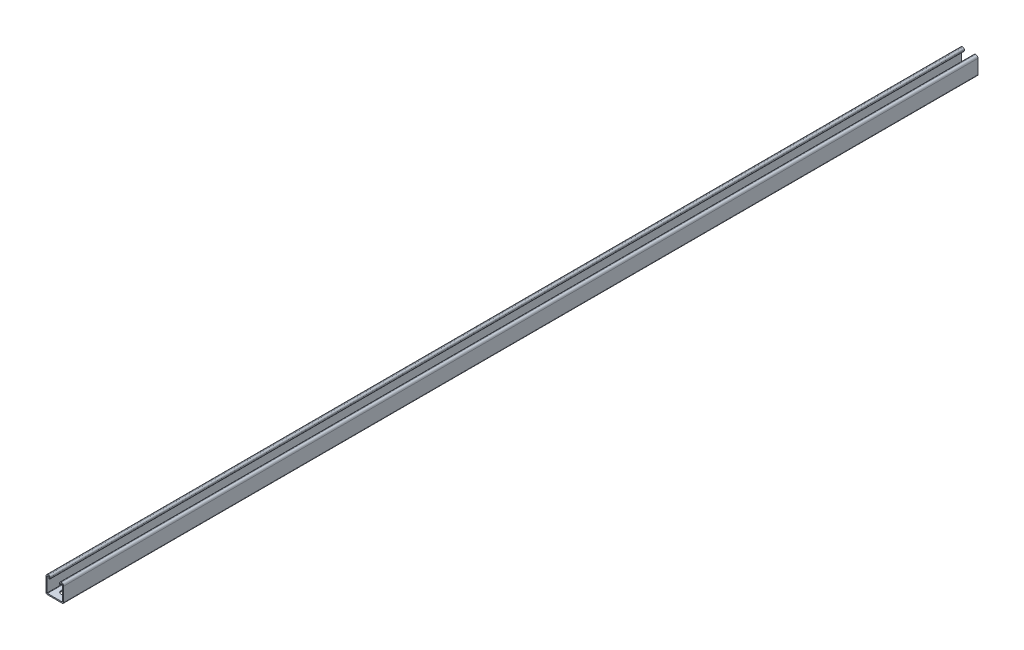
from build123d import *

# Parameters (mm, degrees)
PRIMARY_EXTRUSION_DEPTH = 2133.6
SLOT_CUT_REACH          = 2136.099
LPATTERN1_COUNT         = 42
LPATTERN1_PITCH         = 50.8


with BuildPart() as part:
    # Sketch1 → Primary Extrusion (new body)
    with BuildSketch(Plane.XY):
        with BuildLine():
            Line((17.176891111, -17.970376528), (-17.176891111, -17.970376528))
            ThreePointArc((-17.176891111, -17.970376528), (-17.738157147, -17.737892523), (-17.970641152, -17.176626487))
            Line((-17.970641152, -17.176626487), (-17.970641152, 15.589126408))
            ThreePointArc((-17.970641152, 15.589126408), (-17.273189139, 17.272924515), (-15.589391032, 17.970376528))
            Line((-15.589391032, 17.970376528), (-14.57342631, 17.970376528))
            ThreePointArc((-14.57342631, 17.970376528), (-14.012171972, 17.737897369), (-13.779692813, 17.176643031))
            Line((-13.779692813, 17.176643031), (-13.779692813, 14.833457753))
            ThreePointArc((-13.779692813, 14.833457753), (-12.446175174, 13.499940114), (-11.112657535, 14.833457753))
            Line((-11.112657535, 14.833457753), (-11.112657535, 17.176643031))
            ThreePointArc((-11.112657535, 17.176643031), (-12.126293241, 19.623776099), (-14.57342631, 20.637411806))
            Line((-14.57342631, 20.637411806), (-15.589391032, 20.637411806))
            ThreePointArc((-15.589391032, 20.637411806), (-19.15906787, 19.158803246), (-20.637676429, 15.589126408))
            Line((-20.637676429, 15.589126408), (-20.637676429, -17.176626487))
            ThreePointArc((-20.637676429, -17.176626487), (-19.624035878, -19.623771254), (-17.176891111, -20.637411806))
            Line((-17.176891111, -20.637411806), (17.176891111, -20.637411806))
            ThreePointArc((17.176891111, -20.637411806), (19.624035878, -19.623771254), (20.637676429, -17.176626487))
            Line((20.637676429, -17.176626487), (20.637676429, 15.589126408))
            ThreePointArc((20.637676429, 15.589126408), (19.15906787, 19.158803246), (15.589391032, 20.637411806))
            Line((15.589391032, 20.637411806), (14.57342631, 20.637411806))
            ThreePointArc((14.57342631, 20.637411806), (12.126293241, 19.623776099), (11.112657535, 17.176643031))
            Line((11.112657535, 17.176643031), (11.112657535, 14.833457753))
            ThreePointArc((11.112657535, 14.833457753), (12.446175174, 13.499940114), (13.779692813, 14.833457753))
            Line((13.779692813, 14.833457753), (13.779692813, 17.176643031))
            ThreePointArc((13.779692813, 17.176643031), (14.012171972, 17.737897369), (14.57342631, 17.970376528))
            Line((14.57342631, 17.970376528), (15.589391032, 17.970376528))
            ThreePointArc((15.589391032, 17.970376528), (17.273189139, 17.272924515), (17.970641152, 15.589126408))
            Line((17.970641152, 15.589126408), (17.970641152, -17.176626487))
            ThreePointArc((17.970641152, -17.176626487), (17.738157147, -17.737892523), (17.176891111, -17.970376528))
        make_face()
    extrude(amount=-PRIMARY_EXTRUSION_DEPTH)

    # Sketch58 → Slot Cut (cut, up to next)
    with BuildSketch(Plane(origin=(0, -20.637411806, 0), x_dir=(-1, 0, 0), z_dir=(0, 1, 0)), mode=Mode.PRIVATE) as slot_cut_sk1:
        with BuildLine():
            Line((7.14375, -29.36875), (7.14375, -21.43125))
            ThreePointArc((7.14375, -21.43125), (0, -14.2875), (-7.14375, -21.43125))
            Line((-7.14375, -21.43125), (-7.14375, -29.36875))
            ThreePointArc((-7.14375, -29.36875), (0, -36.5125), (7.14375, -29.36875))
        make_face()
    slot_cut_tool1 = extrude(slot_cut_sk1.sketch, amount=SLOT_CUT_REACH, mode=Mode.PRIVATE) & part.part
    slot_cut = slot_cut_tool1.solids().sort_by_distance((0, -20.637412, -25.4))[0]
    add(slot_cut, mode=Mode.SUBTRACT)

    # LPattern1: Slot Cut ×42
    with Locations(*[(0, 0, -i * LPATTERN1_PITCH) for i in range(1, LPATTERN1_COUNT)]):
        add(slot_cut, mode=Mode.SUBTRACT)


solid = part.part
